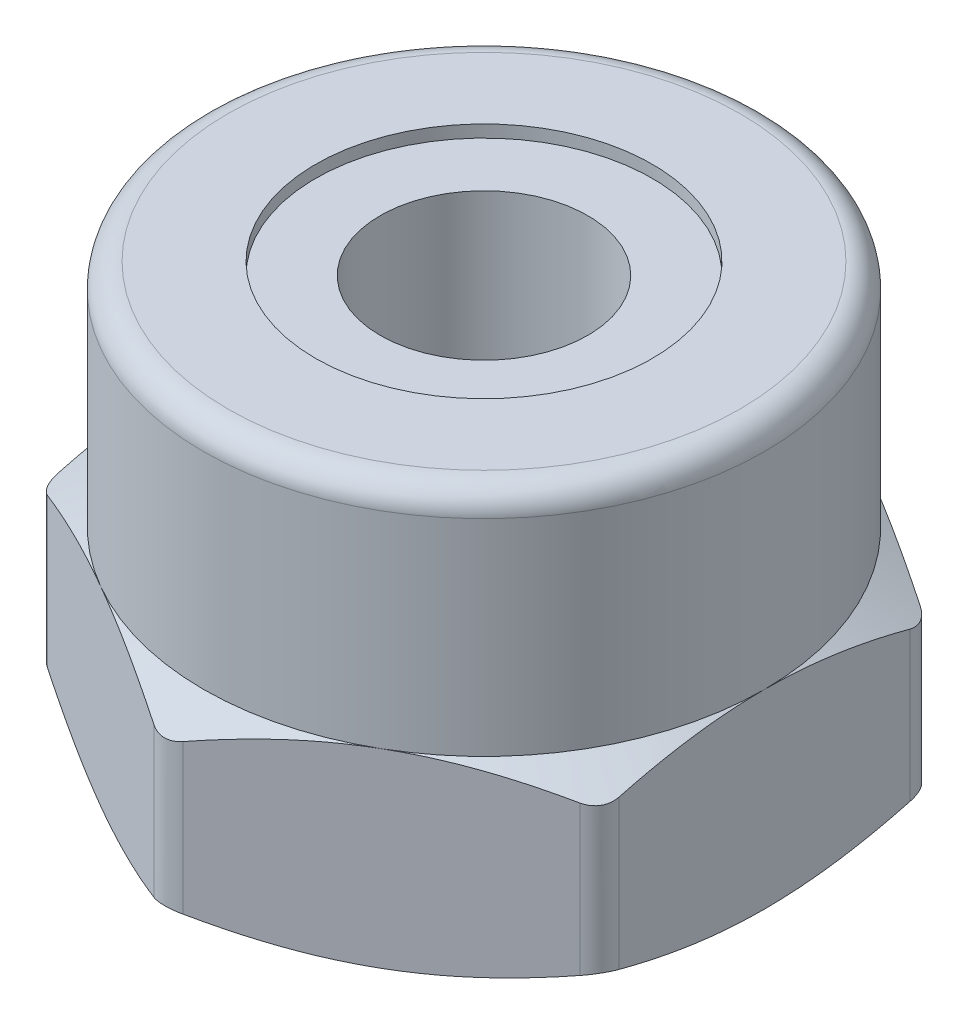
from build123d import *
from build123d.topology import SkipClean

# Parameters (mm, degrees)
BOSS_EXTRUDE1_START = -0.143326
BOSS_EXTRUDE1_DEPTH = 1.356674
FILLET1_R           = 0.205925926
SWEEP1_PITCH        = 0.4


with BuildPart() as part:
    # Sketch2 → Boss-Extrude1 (new body)
    with BuildSketch(Plane(origin=(0, 0, 0), x_dir=(1, 0, 0), z_dir=(0, 1, 0)).offset(BOSS_EXTRUDE1_START)):
        Polygon((2, 1.154700538), (0, 2.309401077), (-2, 1.154700538), (-2, -1.154700538), (0, -2.309401077), (2, -1.154700538), align=None)
    extrude(amount=-BOSS_EXTRUDE1_DEPTH)

    # Sketch3 → Cut-Revolve1 (revolve, cut)
    with BuildSketch(Plane.XY):
        Polygon((1, 0.434024435), (2.318888889, -0.32743642), (2.318888889, 0.434024435), align=None)
        Polygon((1, -2.077350269), (2.318888889, -1.315889414), (2.318888889, -2.077350269), align=None)
    revolve(axis=Axis((0, 1.5, 0), (0, -1, 0)), mode=Mode.SUBTRACT)

    # Fillet1
    fillet1_edges = [part.edges().sort_by_distance(p)[0] for p in [
        (-2, -0.821662917, -1.154700538),
        (-2, -0.821662917, 1.154700538),
        (0, -0.821662917, 2.309401077),
        (0, -0.821662917, -2.309401077),
        (2, -0.821662917, -1.154700538),
        (2, -0.821662917, 1.154700538),
    ]]
    fillet(fillet1_edges, radius=FILLET1_R)

    # Sketch5 → Cut-Revolve2 (revolve, cut)
    with BuildSketch(Plane.XY, mode=Mode.PRIVATE) as cut_revolve2_sk:
        Polygon((-1.2, -1.5), (-1, -1.3), (-1, -0.343325834), (-1.2, -0.143325834), (0, -0.143325834), (0, -1.5), align=None)
    revolve(cut_revolve2_sk.sketch.rotate(Axis((0, 1.5, 0), (0, -1, 0)), 270), axis=Axis((0, 1.5, 0), (0, -1, 0)), mode=Mode.SUBTRACT)

    # Sketch4 → Revolve1 (revolve)
    with BuildSketch(Plane.XY, mode=Mode.PRIVATE) as revolve1_sk:
        with BuildLine():
            Line((-1.2, 1.5), (-1.825, 1.5))
            ThreePointArc((-1.825, 1.5), (-1.948743687, 1.448743687), (-2, 1.325))
            Line((-2, 1.325), (-2, -0.143325834))
            Line((-2, -0.143325834), (-1.9125, -0.143325834))
            Line((-1.9125, -0.143325834), (-1.9125, 1.325))
            ThreePointArc((-1.9125, 1.325), (-1.886871843, 1.386871843), (-1.825, 1.4125))
            Line((-1.825, 1.4125), (-1.2, 1.4125))
            Line((-1.2, 1.4125), (-1.2, 1.5))
        make_face()
    revolve(revolve1_sk.sketch.rotate(Axis((0, 1.5, 0), (0, -1, 0)), 270), axis=Axis((0, 1.5, 0), (0, -1, 0)))

    # Sweep1: the profile of Sketch8 profile screwed along a left-hand helix of 7.5 turns, 6 arcs to a turn; built about Z, then put on its axis
    sweep1_z = Axis((0, 0, 0), (0, 0, 1))
    sweep1_corners = [(1.021650635, 0, 0.0125), (1.021650635, 0, -0.3625), (0.739892379, 0, -0.199826795), (0.739892379, 0, -0.150173205)]
    with BuildLine(mode=Mode.PRIVATE) as sweep1_profile:
        Line(sweep1_corners[0], sweep1_corners[1])
        Line(sweep1_corners[1], sweep1_corners[2])
        Line(sweep1_corners[2], sweep1_corners[3])
        Line(sweep1_corners[3], sweep1_corners[0])
    sweep1_cap = Face(sweep1_profile.wire())
    sweep1_turn_angles = [0, -30, -60, -90, -120, -150, -180, -210, -240, -270, -300, -330, -360]
    sweep1_turn_weights = [1, 0.8660254037844387, 1, 0.8660254037844387, 1, 0.8660254037844387, 1, 0.8660254037844387, 1, 0.8660254037844387, 1, 0.8660254037844387, 1]
    sweep1_turn_rails = [Edge.make_bspline([Vector(p[0], p[1], 0).rotate(sweep1_z, sweep1_turn_angles[k]) / sweep1_turn_weights[k] + Vector(0, 0, p[2] + -SWEEP1_PITCH * sweep1_turn_angles[k] / 360) for k in range(13)], [0, 0, 0, 1, 1, 2, 2, 3, 3, 4, 4, 5, 5, 6, 6, 6], 2, sweep1_turn_weights) for p in sweep1_corners]
    sweep1_turn_sides = [Face.make_surface_from_curves(sweep1_turn_rails[p[0]], sweep1_turn_rails[p[1]]) for p in [(0, 1), (1, 2), (2, 3), (3, 0)]]
    sweep1_last_angles = [-2520, -2550, -2580, -2610, -2640, -2670, -2700]
    sweep1_last_weights = [1, 0.8660254037844387, 1, 0.8660254037844387, 1, 0.8660254037844426, 1]
    sweep1_last_rails = [Edge.make_bspline([Vector(p[0], p[1], 0).rotate(sweep1_z, sweep1_last_angles[k]) / sweep1_last_weights[k] + Vector(0, 0, p[2] + -SWEEP1_PITCH * sweep1_last_angles[k] / 360) for k in range(7)], [0, 0, 0, 1, 1, 2, 2, 3, 3, 3], 2, sweep1_last_weights) for p in sweep1_corners]
    sweep1_last_sides = [Face.make_surface_from_curves(sweep1_last_rails[p[0]], sweep1_last_rails[p[1]]) for p in [(0, 1), (1, 2), (2, 3), (3, 0)]]
    sweep1 = Plane(origin=(0, -1.5, 0), x_dir=(-1, 0, 0), z_dir=(0, 1, 0)) * Solid(Shell([*[p.moved(Location((0, 0, SWEEP1_PITCH * i))) for i in range(7) for p in sweep1_turn_sides], *sweep1_last_sides, sweep1_cap, sweep1_cap.rotate(sweep1_z, -2700).moved(Location((0, 0, -SWEEP1_PITCH * -2700 / 360)))]))
    add(sweep1)

    # Sketch9 → Cut-Revolve3 (revolve, cut)
    with SkipClean():  # the faces are left unmerged after this step: merging them gives an invalid solid
        with BuildSketch(Plane.XY, mode=Mode.PRIVATE) as cut_revolve3_sk:
            Polygon((-1.2, 1.5875), (-1.2, -0.143325834), (-0.696891109, -0.646434725), (-0.696891109, 1.5875), align=None)
            Polygon((-0.696891109, -0.996891109), (-1.2, -1.5), (-1.2, -1.875), (-0.696891109, -1.875), align=None)
        revolve(cut_revolve3_sk.sketch.rotate(Axis((0, 1.5, 0), (0, -1, 0)), 135.522101727), axis=Axis((0, 1.5, 0), (0, -1, 0)), mode=Mode.SUBTRACT)


with BuildPart() as body_2:
    # Sketch6 → Revolve2 (revolve)
    with BuildSketch(Plane.XY, mode=Mode.PRIVATE) as revolve2_sk:
        with BuildLine():
            Line((-1.825, 1.4125), (-0.740192379, 1.4125))
            Line((-0.740192379, 1.4125), (-0.740192379, -0.143325834))
            Line((-0.740192379, -0.143325834), (-1.9125, -0.143325834))
            Line((-1.9125, -0.143325834), (-1.9125, 1.325))
            ThreePointArc((-1.9125, 1.325), (-1.886871843, 1.386871843), (-1.825, 1.4125))
        make_face()
    revolve(revolve2_sk.sketch.rotate(Axis((0, 1.5, 0), (0, -1, 0)), 270), axis=Axis((0, 1.5, 0), (0, -1, 0)))


solid = Compound([part.part, body_2.part])
